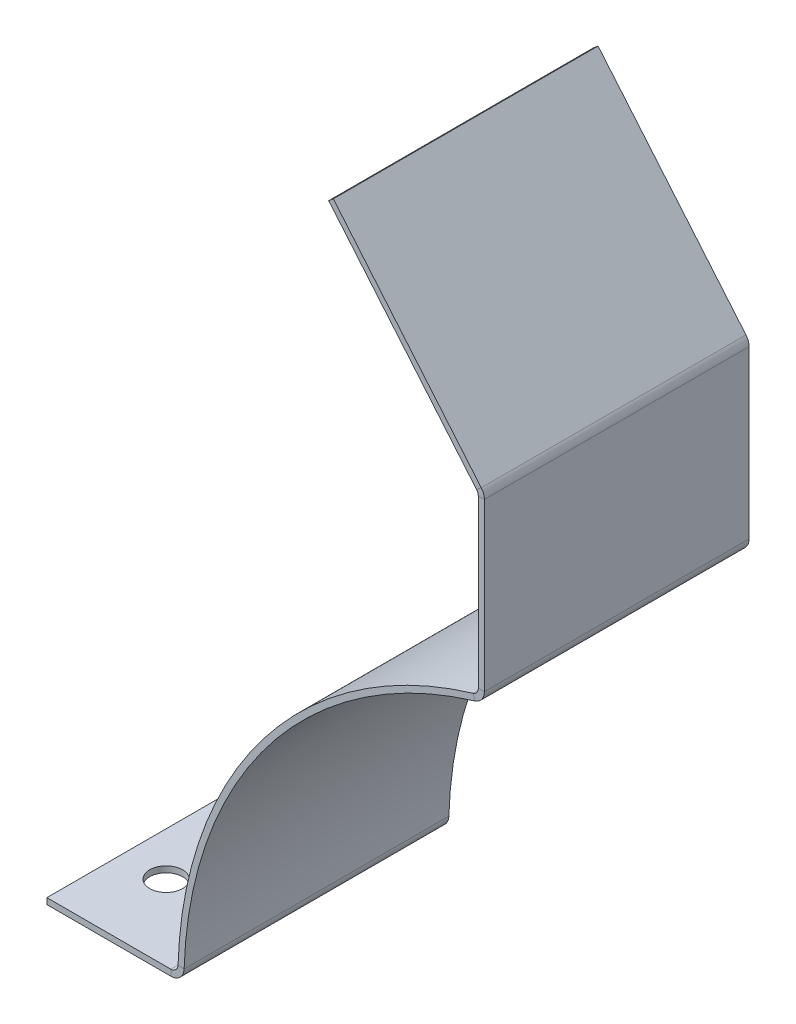
from build123d import *

# Parameters (mm, degrees)
BASE_FLANGE1_DEPTH           = 115.57
EDGE_FLANGE1_DEPTH           = 115.57
EDGE_FLANGE2_STRIP_CUT_DEPTH = 115.57
EDGE_FLANGE2_DEPTH           = 115.57
EDGE_FLANGE3_DEPTH           = 115.57
SKETCH20_R                   = 7.14375
CUT_EXTRUDE1_DEPTH           = 2.65684


# Sheet-metal steps are written as plain solids
with BuildPart() as part:
    # Sketch1 → Base-Flange1 (new body)
    with BuildSketch(Plane.XY):
        with BuildLine():
            ThreePointArc((-50.8, 170.388379885), (-140.856418383, 108.500273734), (-177.710803869, 5.63118))
            Line((-177.710803869, 5.63118), (-180.366311024, 5.715325918))
            ThreePointArc((-180.366311024, 5.715325918), (-142.961215721, 110.121577824), (-51.559097143, 172.934469105))
            Line((-51.559097143, 172.934469105), (-50.8, 170.388379885))
        make_face()
    extrude(amount=BASE_FLANGE1_DEPTH)

    # Edge-Flange1 section (across the edge) → Edge-Flange1 (add)
    with BuildSketch(Plane(origin=(-49.291175996, 173.610632552, 115.57), x_dir=(-0.9999999996342678, -2.7045604981235094e-05, 0), z_dir=(0, 0, -1))):
        with BuildLine():
            Line((-2.65684, 2.366572064), (-2.65684, 76.2))
            Line((-2.65684, 76.2), (0, 76.2))
            Line((0, 76.2), (0, 2.366572064))
            ThreePointArc((0, 2.366572064), (0.62936233, 0.469112223), (2.267939433, -0.676102109))
            Line((2.267939433, -0.676102109), (1.508911151, -3.222211858))
            ThreePointArc((1.508911151, -3.222211858), (-1.500827273, -1.118682173), (-2.65684, 2.366572064))
        make_face()
    extrude(amount=EDGE_FLANGE1_DEPTH)

    # Edge-Flange2 strip (across the edge) → Edge-Flange2 strip cut (cut)
    with BuildSketch(Plane(origin=(-49.293236871, 249.810632524, 115.57), x_dir=(-0.766027058259036, -0.6428083275868535, 0), z_dir=(0, 0, -1))):
        Polygon((-12.205285278, 10.412383287), (-1.292448625, -2.593029), (0.742808893, -0.885245167), (-10.17002776, 12.12016712), align=None)
    extrude(amount=EDGE_FLANGE2_STRIP_CUT_DEPTH, mode=Mode.SUBTRACT)

    # Edge-Flange2 section (across the edge) → Edge-Flange2 (add)
    with BuildSketch(Plane(origin=(-49.293236871, 249.810632524, 115.57), x_dir=(-0.766027058259036, -0.6428083275868535, 0), z_dir=(0, 0, -1))):
        with BuildLine():
            Line((-2.65684, 1.155605494), (-2.65684, 101.6))
            Line((-2.65684, 101.6), (0, 101.6))
            Line((0, 101.6), (0, 1.155605494))
            ThreePointArc((0, 1.155605494), (0.191475929, 0.069691539), (0.742808893, -0.885245167))
            Line((0.742808893, -0.885245167), (-1.292448625, -2.593029))
            ThreePointArc((-1.292448625, -2.593029), (-2.305137014, -0.839001259), (-2.65684, 1.155605494))
        make_face()
    extrude(amount=EDGE_FLANGE2_DEPTH)

    # Edge-Flange3 section (across the edge) → Edge-Flange3 (add)
    with BuildSketch(Plane(origin=(-180.463740314, 2.640617339, 0), x_dir=(8.626632785422443e-05, 0.9999999962790604, 0), z_dir=(0, 0, 1))):
        with BuildLine():
            Line((-2.65684, 3.076251829), (-2.65684, 57.15))
            Line((-2.65684, 57.15), (0, 57.15))
            Line((0, 57.15), (0, 3.076251829))
            ThreePointArc((0, 3.076251829), (0.894756196, 0.86692768), (3.074716973, -0.097164046))
            Line((3.074716973, -0.097164046), (2.990800136, -2.75267845))
            ThreePointArc((2.990800136, -2.75267845), (-1.013351819, -0.981834768), (-2.65684, 3.076251829))
        make_face()
    extrude(amount=EDGE_FLANGE3_DEPTH)

    # Sketch20 → Cut-Extrude1 (cut)
    with BuildSketch(Plane(origin=(0.000226453, 2.625049375, 0), x_dir=(0.9999999962790604, -8.626632785420363e-05, 0), z_dir=(8.626632785420363e-05, 0.9999999962790604, 0))):
        with Locations(Location((-218.563967439, -31.75, 0), (0, 0, 180))):
            Circle(SKETCH20_R)
        with Locations(Location((-218.563967439, -82.55, 0), (0, 0, 180))):
            Circle(SKETCH20_R)
    extrude(amount=-CUT_EXTRUDE1_DEPTH, mode=Mode.SUBTRACT)


solid = part.part
